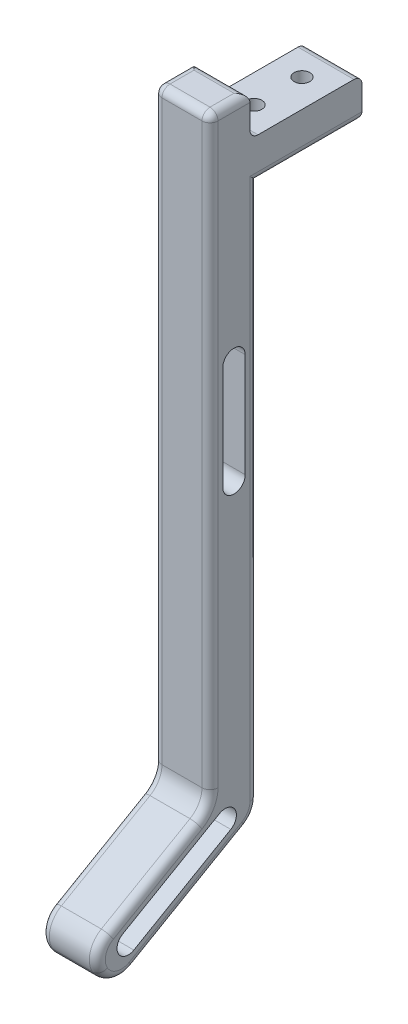
from build123d import *

# Parameters (mm, degrees)
BOSS_EXTRUDE1_DEPTH     = 8.89
CUT_EXTRUDE1_DEPTH      = 10.16
CUT_EXTRUDE2_DEPTH      = 10.16
TAP_DRILL_FOR_M3_TAP1_D = 2.5
FILLET5_R               = 1.27
FILLET6_R               = 3.81
FILLET7_R               = 1.27


with BuildPart() as part:
    # Sketch1 → Boss-Extrude1 (new body)
    with BuildSketch(Plane(origin=(0, 0, 0), x_dir=(0, 0, -1), z_dir=(1, 0, 0))):
        Polygon((-2.31554316, -8.033202767), (20.781354359, 5.301797233), (20.781354359, 92.169797233), (37.291354359, 92.169797233), (37.291354359, 98.519797233), (19.511354359, 98.519797233), (19.511354359, 104.869797233), (13.161354359, 104.869797233), (13.161354359, 9.701206284), (-6.12554316, -1.43408919), align=None)
    extrude(amount=BOSS_EXTRUDE1_DEPTH)

    # Sketch2 → Cut-Extrude1 (cut)
    with BuildSketch(Plane(origin=(8.89, 0, 0), x_dir=(0, 0, -1), z_dir=(1, 0, 0))):
        with BuildLine():
            Line((1.067865891, -3.733439147), (16.465797571, 5.156560853))
            ThreePointArc((16.465797571, 5.156560853), (17.116590739, 7.585354021), (14.687797571, 8.236147189))
            Line((14.687797571, 8.236147189), (-0.710134109, -0.653852811))
            ThreePointArc((-0.710134109, -0.653852811), (-1.360927276, -3.082645979), (1.067865891, -3.733439147))
        make_face()
    extrude(amount=-CUT_EXTRUDE1_DEPTH, mode=Mode.SUBTRACT)

    # Sketch3 → Cut-Extrude2 (cut)
    with BuildSketch(Plane(origin=(8.89, 0, 0), x_dir=(0, 0, -1), z_dir=(1, 0, 0))):
        with BuildLine():
            Line((15.193354359, 69.309797233), (15.193354359, 52.799797233))
            ThreePointArc((15.193354359, 52.799797233), (16.971354359, 51.021797233), (18.749354359, 52.799797233))
            Line((18.749354359, 52.799797233), (18.749354359, 69.309797233))
            ThreePointArc((18.749354359, 69.309797233), (16.971354359, 71.087797233), (15.193354359, 69.309797233))
        make_face()
    extrude(amount=-CUT_EXTRUDE2_DEPTH, mode=Mode.SUBTRACT)

    # Tap Drill for M3 Tap1 (through all)
    with Locations(Plane(origin=(0, 98.519797233, 0), x_dir=(1, 0, 0), z_dir=(0, 1, 0))):
        with Locations((4.445, 32.211354359), (4.445, 24.591354359)):
            Hole(TAP_DRILL_FOR_M3_TAP1_D / 2)

    # Fillet5
    fillet5_edges = [part.edges().sort_by_distance(p)[0] for p in [
        (4.445, 98.519797233, -19.511354359),
        (4.445, 98.519797233, -37.291354359),
    ]]
    fillet(fillet5_edges, radius=FILLET5_R)

    # Fillet6
    fillet6_edges = [part.edges().sort_by_distance(p)[0] for p in [
        (4.445, 9.701206284, -13.161354359),
        (4.445, 5.301797233, -20.781354359),
        (4.445, -8.033202767, 2.31554316),
        (4.445, -1.43408919, 6.12554316),
    ]]
    fillet(fillet6_edges, radius=FILLET6_R - 0.0001)  # a hair under: the kernel refuses the full size

    # Fillet7
    fillet7_edges = [part.edges().sort_by_distance(p)[0] for p in [
        (8.89, 5.596494023, -20.270924545),
        (0, 9.995903075, -12.650924545),
        (8.89, 9.995903075, -12.650924545),
        (0, 104.869797233, -16.336354359),
        (0, 92.169797233, -29.036354359),
        (8.89, 92.169797233, -29.036354359),
        (4.445, 104.869797233, -13.161354359),
        (4.445, 104.869797233, -19.511354359),
        (4.445, 92.169797233, -37.291354359),
        (8.89, 104.869797233, -16.336354359),
        (8.89, 58.385325154, -13.161354359),
        (0, 4.536121849, -4.215165693),
        (8.89, 4.536121849, -4.215165693),
        (0, 49.835620628, -20.781354359),
        (8.89, 49.835620628, -20.781354359),
        (0, -0.963139465, -9.930165693),
        (0, -1.842534696, 4.601203779),
        (0, -6.508863387, 1.907097654),
        (0, 5.596494023, -20.270924545),
        (0, 58.385325154, -13.161354359),
        (8.89, -0.963139465, -9.930165693),
        (8.89, -1.842534696, 4.601203779),
        (8.89, -6.508863387, 1.907097654),
    ]]
    fillet(fillet7_edges, radius=FILLET7_R)


solid = part.part
